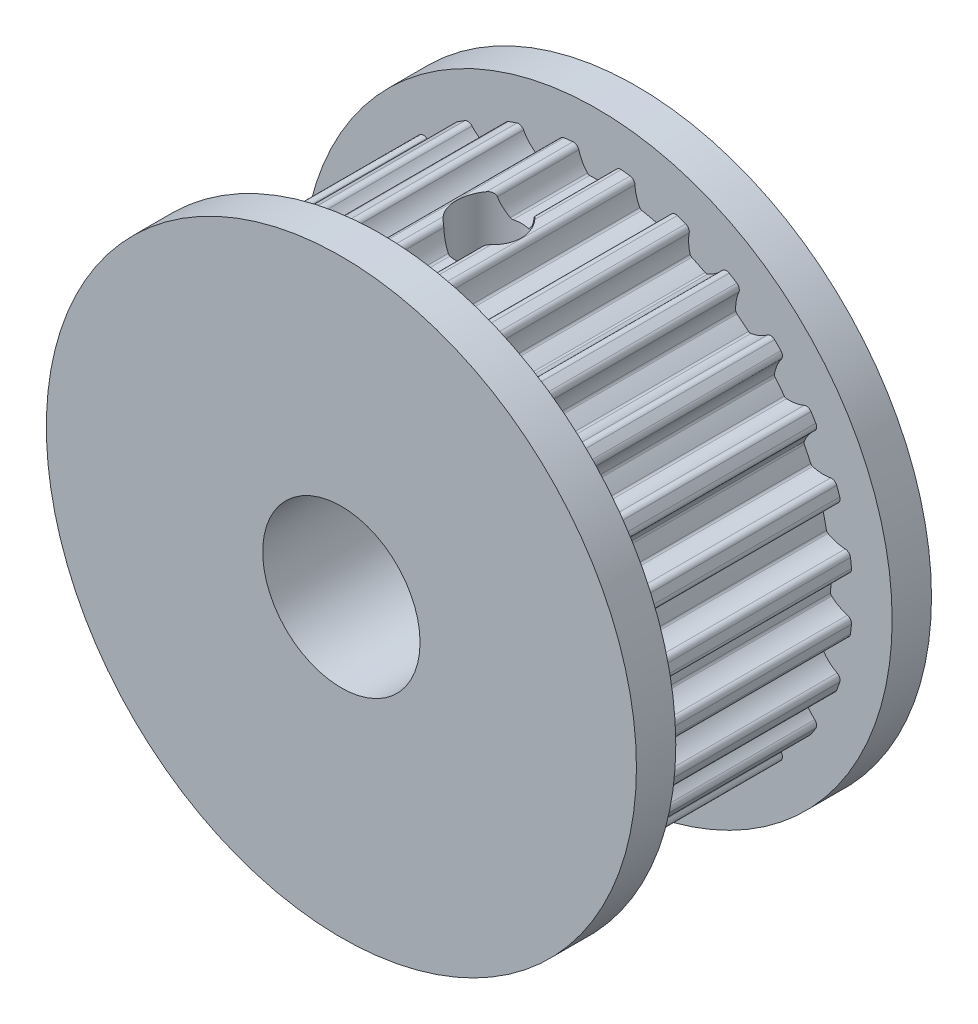
from build123d import *

# Parameters (mm, degrees)
SKETCH_1_R               = 12.99
EXTRUDE_1_DEPTH          = 5.5
CUT_EXTRUDE_1_DEPTH      = 22.412150756
PATTERN_CIRCULAR_1_COUNT = 28
SKETCH_3_R               = 15
EXTRUDE_2_DEPTH          = 2
SKETCH_4_R               = 4
CUT_EXTRUDE_2_DEPTH      = 26.980762114
SKETCH_6_W               = 1.65
SKETCH_6_H               = 15
PATTERN_CIRCULAR_2_COUNT = 2
PATTERN_CIRCULAR_2_ANGLE = 90


with BuildPart() as part:
    # 草圖1 → 填料-伸長1 (new, symmetric)
    with BuildSketch(Plane.XY):
        Circle(SKETCH_1_R)
    extrude(amount=EXTRUDE_1_DEPTH, both=True)

    # 草圖2 → 除料-伸長1 (cut, symmetric)
    with BuildSketch(Plane.XY.offset(5.5)):
        with BuildLine():
            Line((-70.048095585, 6.398480172), (-1.227668901, 12.931857139))
            ThreePointArc((-1.227668901, 12.931857139), (-1.041836125, 12.883330091), (-0.930990124, 12.726480294))
            ThreePointArc((-0.930990124, 12.726480294), (-0.759471272, 12.299418395), (-0.493772121, 11.923646466))
            ThreePointArc((-0.493772121, 11.923646466), (-0.441100842, 11.885966255), (-0.377453975, 11.874002211))
            ThreePointArc((-0.377453975, 11.874002211), (0, 11.88), (0.377453975, 11.874002211))
            ThreePointArc((0.377453975, 11.874002211), (0.441100842, 11.885966255), (0.493772121, 11.923646466))
            ThreePointArc((0.493772121, 11.923646466), (0.759471272, 12.299418395), (0.930990124, 12.726480294))
            ThreePointArc((0.930990124, 12.726480294), (1.041836125, 12.883330091), (1.227668901, 12.931857139))
            Line((1.227668901, 12.931857139), (70.048095585, 6.398480172))
            Line((70.048095585, 6.398480172), (70.048095585, 144.65817992))
            Line((70.048095585, 144.65817992), (-70.048095585, 144.65817992))
            Line((-70.048095585, 144.65817992), (-70.048095585, 6.398480172))
        make_face()
    cut_extrude_1 = extrude(amount=CUT_EXTRUDE_1_DEPTH, both=True, mode=Mode.SUBTRACT)

    # 環狀複製排列1: 除料-伸長1 ×28 about axis
    pattern_circular_1_axis = Axis((0, 0, 5.5), (0, 0, 1))
    for i in range(1, PATTERN_CIRCULAR_1_COUNT):
        add(cut_extrude_1.rotate(pattern_circular_1_axis, i * 360 / PATTERN_CIRCULAR_1_COUNT), mode=Mode.SUBTRACT)

    # 草圖3 → 填料-伸長2 (add)
    with BuildSketch(Plane.XY.offset(5.5)):
        Circle(SKETCH_3_R)
    extrude_2 = extrude(amount=EXTRUDE_2_DEPTH)

    # 鏡射1: 填料-伸長2 across plane
    add(extrude_2.mirror(Plane.XY))

    # 草圖4 → 除料-伸長2 (cut, through all)
    with BuildSketch(Plane.XY.offset(7.5)):
        Circle(SKETCH_4_R)
    extrude(amount=-CUT_EXTRUDE_2_DEPTH, mode=Mode.SUBTRACT)

    # 草圖6 → M4x0.7 螺紋孔1 (revolve, cut)
    with BuildSketch(Plane(origin=(0, 0, 0), x_dir=(0, 0, -1), z_dir=(1, 0, 0))):
        with Locations((0.825, 7.5)):
            Rectangle(SKETCH_6_W, SKETCH_6_H)
    m4x0_7_1 = revolve(axis=Axis((0, -6.35, 0), (0, 1, 0)), mode=Mode.SUBTRACT)

    # 環狀複製排列2: M4x0.7 螺紋孔1 ×2 about axis
    pattern_circular_2_axis = Axis((0, 0, 7.5), (0, 0, 1))
    for i in range(1, PATTERN_CIRCULAR_2_COUNT):
        add(m4x0_7_1.rotate(pattern_circular_2_axis, i * PATTERN_CIRCULAR_2_ANGLE / (PATTERN_CIRCULAR_2_COUNT - 1)), mode=Mode.SUBTRACT)


solid = part.part
